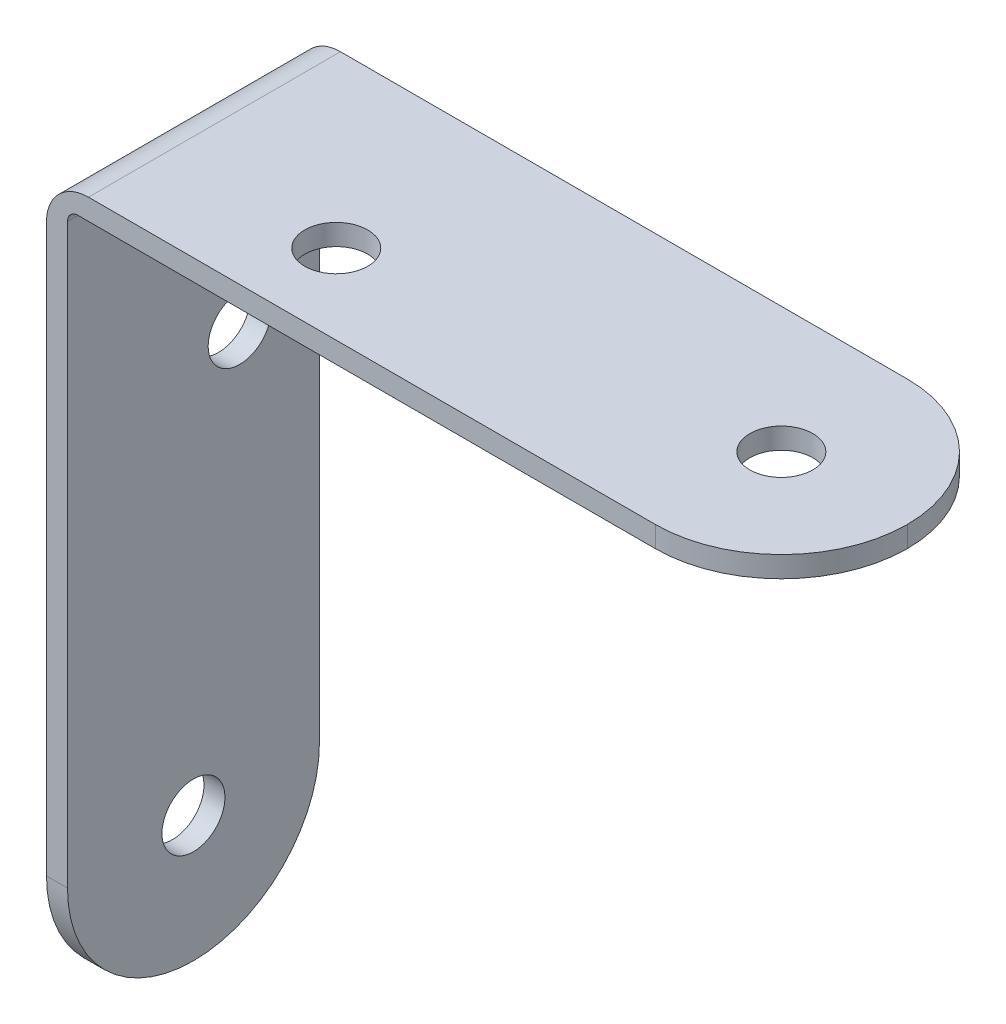
from build123d import *

# Parameters (mm, degrees)
EXTRUDE_1_DEPTH     = 12
FILLET_1_R          = 6
FILLET_2_R          = 2
FILLET_3_R          = 0.5
SKETCH_2_R          = 1.5
CUT_EXTRUDE_1_DEPTH = 51.931326313
SKETCH_3_R          = 1.5
CUT_EXTRUDE_2_DEPTH = 51.931326313


with BuildPart() as part:
    # 草图1 → 凸台-拉伸1 (new body)
    with BuildSketch(Plane.XY):
        Polygon((0, 0), (35, 0), (35, -1), (1, -1), (1, -35), (0, -35), align=None)
    extrude(amount=EXTRUDE_1_DEPTH)

    # 圆角1
    fillet_1_edges = [part.edges().sort_by_distance(p)[0] for p in [
        (0.5, -35, 12),
        (0.5, -35, 0),
        (35, -0.5, 0),
        (35, -0.5, 12),
    ]]
    fillet(fillet_1_edges, radius=FILLET_1_R - 0.0001)  # a hair under: the kernel refuses the full size

    # 圆角2
    fillet_2_edges = [part.edges().sort_by_distance(p)[0] for p in [
        (0, 0, 6),
    ]]
    fillet(fillet_2_edges, radius=FILLET_2_R)

    # 圆角3
    fillet_3_edges = [part.edges().sort_by_distance(p)[0] for p in [
        (1, -1, 6),
    ]]
    fillet(fillet_3_edges, radius=FILLET_3_R)

    # 草图2 → 切除-拉伸1 (cut, through all)
    with BuildSketch(Plane.ZY):
        with Locations((6, -29)):
            Circle(SKETCH_2_R)
        with Locations((3.8, -10)):
            Circle(SKETCH_2_R)
    extrude(amount=-CUT_EXTRUDE_1_DEPTH, mode=Mode.SUBTRACT)

    # 草图3 → 切除-拉伸2 (cut, through all)
    with BuildSketch(Plane(origin=(0, 0, 0), x_dir=(1, 0, 0), z_dir=(0, 1, 0))):
        with Locations(Location((29, -6, 0), (0, 0, 270))):
            Circle(SKETCH_3_R)
        with Locations(Location((10, -8.2, 0), (0, 0, 270))):
            Circle(SKETCH_3_R)
    extrude(amount=-CUT_EXTRUDE_2_DEPTH, mode=Mode.SUBTRACT)


solid = part.part
